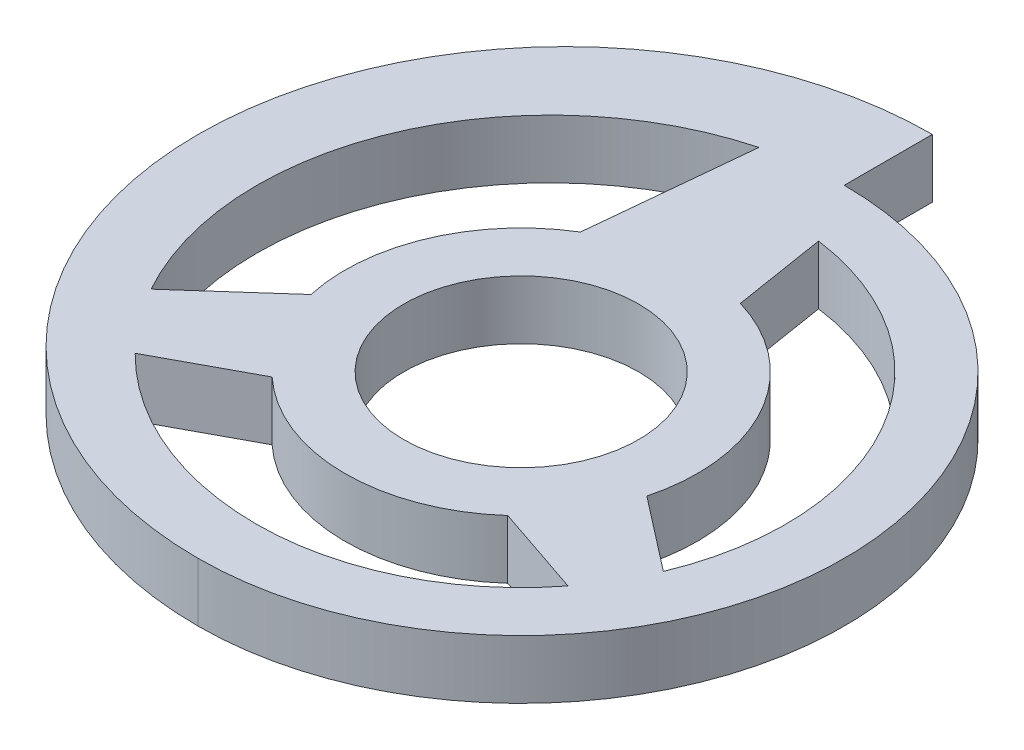
from build123d import *

# Parameters (mm, degrees)
SKETCH1_R           = 20
BOSS_EXTRUDE2_DEPTH = 10


with BuildPart() as part:
    # Sketch1 → Boss-Extrude2 (new body)
    with BuildSketch(Plane(origin=(0, 0, 0), x_dir=(1, 0, 0), z_dir=(0, 1, 0))):
        with BuildLine():
            Line((0, 70), (0, 55))
            ThreePointArc((0, 55), (55, 0), (0, -55))
            ThreePointArc((0, -55), (-62.5, 7.5), (0, 70))
        make_face()
        Circle(SKETCH1_R, mode=Mode.SUBTRACT)
        with BuildLine():
            Line((6.043336578, 44.532634), (8.56956825, 28.75))
            ThreePointArc((8.56956825, 28.75), (26.151004312, 14.701189526), (29.01593452, -7.620731195))
            Line((29.01593452, -7.620731195), (41.531970764, -17.323261945))
            ThreePointArc((41.531970764, -17.323261945), (39.032109119, 22.394071932), (6.005940043, 44.597406698))
            Line((6.005940043, 44.597406698), (6.043336578, 44.532634))
        make_face(mode=Mode.SUBTRACT)
        with BuildLine():
            Line((-35.589482273, -30.119634843), (-20.436536818, -21.962421607))
            ThreePointArc((-20.436536818, -21.962421607), (-0.267938851, -29.998803456), (20.040986366, -22.323952729))
            Line((20.040986366, -22.323952729), (35.557823221, -27.579724578))
            ThreePointArc((35.557823221, -27.579724578), (19.797883649, -40.410936676), (0, -45))
            ThreePointArc((0, -45), (-19.287538177, -41.130151431), (-35.589482273, -30.119634843))
        make_face(mode=Mode.SUBTRACT)
        with BuildLine():
            Line((-12.837310998, 53.323942785), (-15.563246971, 25.647326249))
            ThreePointArc((-15.563246971, 25.647326249), (-27.589867948, 11.78130666), (-29.288494343, -6.494928722))
            Line((-29.288494343, -6.494928722), (-43.68979466, -19.314642555))
            ThreePointArc((-43.68979466, -19.314642555), (-46.020858734, 24.546881117), (-12.837310998, 53.323942785))
        make_face(mode=Mode.SUBTRACT)
    extrude(amount=BOSS_EXTRUDE2_DEPTH)


solid = part.part
